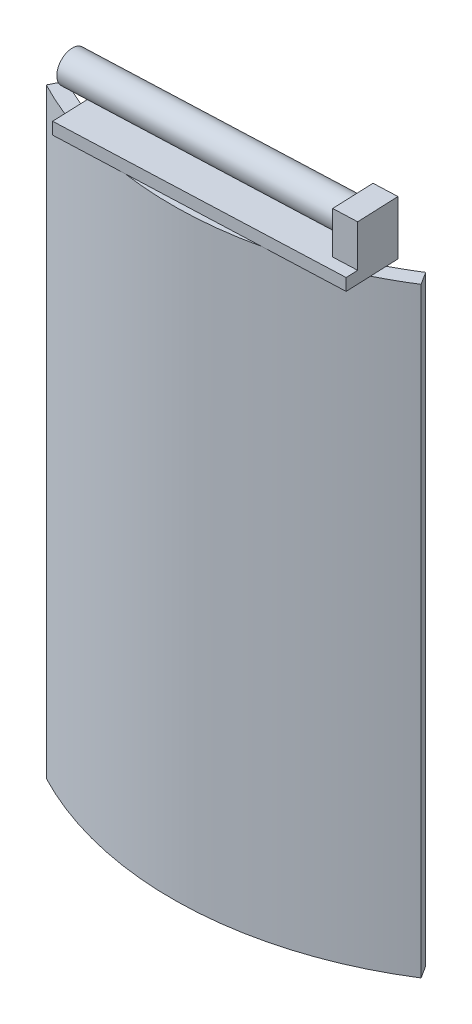
from build123d import *

# Parameters (mm, degrees)
BOSS_EXTRUDE1_DEPTH      = 127
BOSS_EXTRUDE3_REACH      = 135.256
BOSS_EXTRUDE3_END_RADIUS = 73.025
SKETCH4_W                = 12.7
SKETCH4_H                = 127
SKETCH15_W               = 12.7
SKETCH15_H               = 126.996099748
BOSS_EXTRUDE13_DEPTH     = 1.016
SKETCH20_W               = 12.7
SKETCH20_H               = 8.89
BOSS_EXTRUDE18_DEPTH     = 15.24
SKETCH22_R               = 3.302
CUT_EXTRUDE5_DEPTH       = 13.97
BOSS_EXTRUDE23_DEPTH     = 2.54
BOSS_EXTRUDE24_DEPTH     = 8.89
SKETCH30_R               = 3.302
BOSS_EXTRUDE25_DEPTH     = 57.15


with BuildPart() as part:
    # Sketch1 → Boss-Extrude1 (new body)
    with BuildSketch(Plane(origin=(0, 0, 0), x_dir=(1, 0, 0), z_dir=(0, 1, 0))):
        with BuildLine():
            Line((-33.926447143, -64.665654015), (-35.38580203, -67.485442984))
            ThreePointArc((-35.38580203, -67.485442984), (3.097490686, -76.137018273), (40.750822522, -64.387968316))
            Line((40.750822522, -64.387968316), (39.038500804, -61.714229153))
            ThreePointArc((39.038500804, -61.714229153), (2.951440384, -72.965331663), (-33.926447143, -64.665654015))
        make_face()
    extrude(amount=BOSS_EXTRUDE1_DEPTH)

    # Boss-Extrude3: up to this cylinder (the profile starts inside it)
    boss_extrude3_end = Plane(origin=(0, 63.5, 0), z_dir=(0, -1, 0)) * Cylinder(BOSS_EXTRUDE3_END_RADIUS, 417.562, mode=Mode.PRIVATE)
    # Sketch4 → Boss-Extrude3 (add, up to the surface)
    with BuildSketch(Plane(origin=(2.556026831, 0, 63.189941584), x_dir=(0.9991829053446539, 0, -0.04041684880116796), z_dir=(0.04041684880116796, 0, 0.9991829053446539)), mode=Mode.PRIVATE) as boss_extrude3_sk1:
        with Locations((0, 63.5)):
            Rectangle(SKETCH4_W, SKETCH4_H)
    boss_extrude3_tool1 = extrude(boss_extrude3_sk1.sketch, amount=BOSS_EXTRUDE3_REACH, mode=Mode.PRIVATE) & boss_extrude3_end
    add(boss_extrude3_tool1.solids().sort_by_distance((2.556027, 63.5, 63.189942))[0])

    # Sketch15 → Boss-Extrude13 (add)
    with BuildSketch(Plane(origin=(2.556026831, 0, 63.189941584), x_dir=(-0.9991829053446538, 0, 0.04041684880116875), z_dir=(-0.04041684880116875, 0, -0.9991829053446538))):
        with Locations((0, 63.501950126)):
            Rectangle(SKETCH15_W, SKETCH15_H)
    extrude(amount=BOSS_EXTRUDE13_DEPTH)

    # Sketch20 → Boss-Extrude18 (add)
    with BuildSketch(Plane(origin=(2.514963312, 0, 62.174771752), x_dir=(-0.9991829053446538, 0, 0.040416848801168685), z_dir=(-0.040416848801168685, 0, -0.9991829053446538))):
        with Locations((0, 78.135382962)):
            Rectangle(SKETCH20_W, SKETCH20_H)
    extrude(amount=BOSS_EXTRUDE18_DEPTH)

    # Sketch22 → Cut-Extrude5 (cut)
    with BuildSketch(Plane(origin=(-6.344811449, 0, 0.25664699), x_dir=(0.040416848801167964, 0, 0.9991829053446539), z_dir=(-0.9991829053446539, 0, 0.040416848801167964))):
        with Locations((52.065615971, 78.135382962)):
            Circle(SKETCH22_R)
    extrude(amount=-CUT_EXTRUDE5_DEPTH, mode=Mode.SUBTRACT)

    # Sketch23 → Boss-Extrude23 (add)
    with BuildSketch(Plane(origin=(0, 127, 0), x_dir=(1, 0, 0), z_dir=(0, 1, 0))):
        Polygon((-25.523394228, -76.019306105), (34.117833392, -73.6068244), (33.65586881, -62.186163792), (-25.98535881, -64.598645497), align=None)
    extrude(amount=BOSS_EXTRUDE23_DEPTH)

    # Sketch29 → Boss-Extrude24 (add)
    with BuildSketch(Plane(origin=(0, 129.54, 0), x_dir=(1, 0, 0), z_dir=(0, 1, 0))):
        Polygon((33.65586881, -62.186163792), (34.015174596, -71.06889982), (28.939325437, -71.274217412), (28.580019651, -62.391481384), align=None)
    extrude(amount=BOSS_EXTRUDE24_DEPTH)

    # Sketch30 → Boss-Extrude25 (add)
    with BuildSketch(Plane(origin=(26.013726941, 0, -1.052252659), x_dir=(0.040416848801169046, 0, 0.9991829053446538), z_dir=(-0.9991829053446538, 0, 0.040416848801169046))):
        with Locations((67.940615971, 134.747)):
            Circle(SKETCH30_R)
    extrude(amount=BOSS_EXTRUDE25_DEPTH)


solid = part.part
